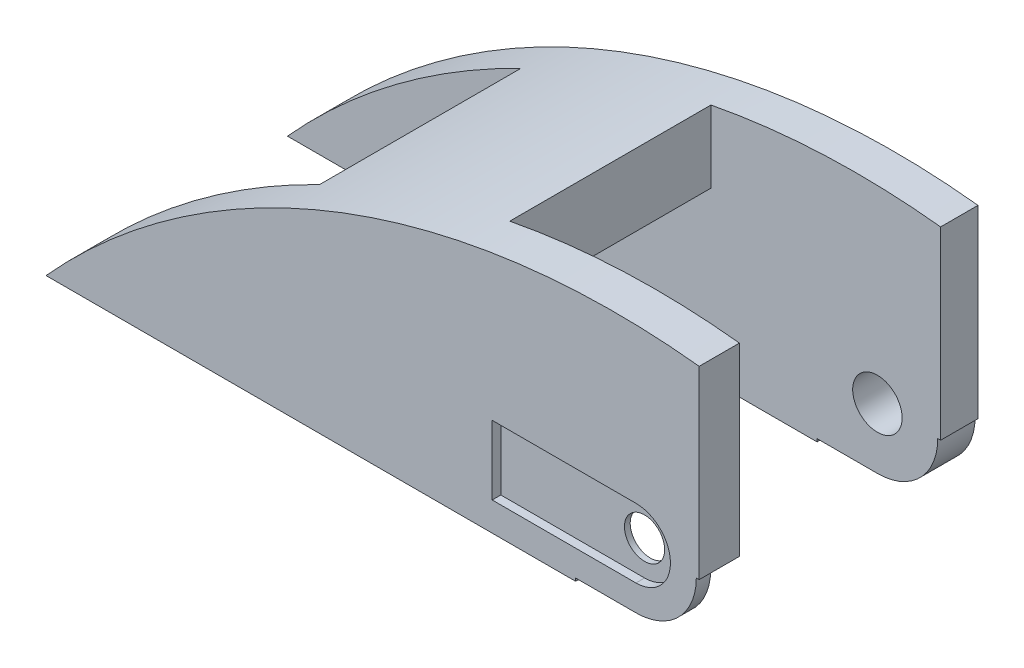
from build123d import *
from build123d.topology import SkipClean

# Parameters (mm, degrees)
SKETCH1_R                 = 9.5
BOSS_EXTRUDE1_DEPTH       = 48
CUT_EXTRUDE1_DEPTH        = 62.48170459575759
BOSS_EXTRUDE2_START       = -2.5
SKETCH3_R                 = 9.5
SKETCH3_R_2               = 2.4
BOSS_EXTRUDE2_DEPTH       = 2.5
SKETCH4_R                 = 9.5
SKETCH4_R_2               = 4.2
BOSS_EXTRUDE3_DEPTH       = 7
SKETCH5_R                 = 4.2
BOSS_EXTRUDE4_DEPTH       = 11
BOSS_EXTRUDE5_DEPTH       = 48
CUT_EXTRUDE2_START        = -48
CUT_EXTRUDE2_OUTLINE_R    = 2.65
CUT_EXTRUDE2_DEPTH        = 48
CUT_EXTRUDE3_START        = -4.5
SKETCH8_R                 = 9.5
CUT_EXTRUDE3_DEPTH        = 4.5
SKETCH9_R                 = 6.067807638148196
CUT_EXTRUDE4_DEPTH        = 4.5
SKETCH10_R                = 9.5
BOSS_EXTRUDE6_DEPTH       = 4.5
SKETCH11_R                = 4.2
BOSS_EXTRUDE7_DEPTH       = 3.5
SKETCH12_R                = 2.4
BOSS_EXTRUDE8_DEPTH       = 2.5
CUT_EXTRUDE5_DEPTH        = 14.500000000000005
SKETCH15_R                = 3.436413098279149
BOSS_EXTRUDE9_DEPTH       = 10
BOSS_EXTRUDE10_DEPTH      = 0.5
SKETCH18_R                = 4.2
CUT_EXTRUDE8_DEPTH        = 0.5
CUT_EXTRUDE9_DEPTH        = 69.52919086053767
BOSS_EXTRUDE11_DEPTH      = 6.9999999999999964
CUT_EXTRUDE10_DEPTH       = 99.24586505293748
BOSS_EXTRUDE12_DEPTH      = 41.5
SKETCH25_R                = 4.2
CUT_EXTRUDE11_DEPTH       = 0.5
BOSS_EXTRUDE13_DEPTH      = 24.25
BOSS_EXTRUDE13_DEPTH_BACK = 24.25
CUT_EXTRUDE12_DEPTH       = 17.25
CUT_EXTRUDE12_DEPTH_BACK  = 17.75
SKETCH28_W                = 40.57640869896728
SKETCH28_H                = 35.258993514097796
SKETCH28_W_2              = 40.750117962367405
SKETCH28_H_2              = 26.870649991533814
SKETCH29_R                = 2.65
SKETCH29_R_2              = 2.5
BOSS_EXTRUDE14_DEPTH      = 2.5
CUT_EXTRUDE13_DEPTH       = 119.18886786333674
SKETCH31_R                = 4.3
CUT_EXTRUDE14_DEPTH       = 111.47362122614281
CUT_EXTRUDE15_DEPTH       = 21.75
SKETCH33_R                = 3.5
CUT_EXTRUDE16_DEPTH       = 21.75
CUT_EXTRUDE17_DEPTH       = 1.5


# Read off the part's stored shape, not the designer's step: Cut-Extrude2
with BuildPart() as part:
    # Sketch1 → Boss-Extrude1 (new body)
    with BuildSketch(Plane.XY):
        with BuildLine():
            Line((-12, 0), (-12, 30))
            Line((-12, 30), (12, 30))
            Line((12, 30), (12, 0))
            ThreePointArc((12, 0), (-2.2e-15, -12), (-12, 0))
        make_face()
        Circle(SKETCH1_R, mode=Mode.SUBTRACT)
    extrude(amount=-BOSS_EXTRUDE1_DEPTH)

    # Sketch2 → Cut-Extrude1 (cut, through all)
    with BuildSketch(Plane.ZY.offset(12)):
        Polygon((-6.999999999999999, -12), (-41, -12.000000000000004), (-41, 18), (-7.000000000000001, 18.000000000000004), align=None)
    extrude(amount=-CUT_EXTRUDE1_DEPTH, mode=Mode.SUBTRACT)

    # Sketch3 → Boss-Extrude2 (add)
    with BuildSketch(Plane(origin=(0, 0, -48), x_dir=(-1, 0, 0), z_dir=(0, 0, -1)).offset(BOSS_EXTRUDE2_START)):
        Circle(SKETCH3_R)
        Circle(SKETCH3_R_2, mode=Mode.SUBTRACT)
    extrude(amount=BOSS_EXTRUDE2_DEPTH)

    # Sketch4 → Boss-Extrude3 (add)
    with BuildSketch(Plane.XY):
        with Locations(Location((0, 0, 0), (0, 0, 180))):
            Circle(SKETCH4_R)
        Circle(SKETCH4_R_2, mode=Mode.SUBTRACT)
    extrude(amount=-BOSS_EXTRUDE3_DEPTH)

    # Sketch5 → Boss-Extrude4 (add)
    with BuildSketch(Plane.XY):
        Circle(SKETCH5_R)
    extrude(amount=-BOSS_EXTRUDE4_DEPTH)

    # Sketch6 → Boss-Extrude5 (add)
    with BuildSketch(Plane(origin=(0, 0, -48), x_dir=(-1, 0, 0), z_dir=(0, 0, -1))):
        Polygon((12, 30), (12, 18), (17.999999999999925, 18), (38.00000000000001, 18), (38.00000000000001, 30), align=None)
    extrude(amount=-BOSS_EXTRUDE5_DEPTH)

    # Cut-Extrude2 outline → Cut-Extrude2 (cut)
    with BuildSketch(Plane.XY.offset(CUT_EXTRUDE2_START)):
        Circle(CUT_EXTRUDE2_OUTLINE_R)
    extrude(amount=CUT_EXTRUDE2_DEPTH, mode=Mode.SUBTRACT)

    # Sketch8 → Cut-Extrude3 (cut)
    with BuildSketch(Plane(origin=(0, -4e-16, -7), x_dir=(-1, 0, 0), z_dir=(0, -6e-17, -1)).offset(CUT_EXTRUDE3_START)):
        Circle(SKETCH8_R)
    extrude(amount=CUT_EXTRUDE3_DEPTH, mode=Mode.SUBTRACT)


with BuildPart() as cut_extrude3_piece_1:
    # of the separate pieces the step leaves, piece 1, a body of its own (cut_extrude3_pieces)
    add(part.part.solids().sort_by_distance((-12, 0, 0))[0])

    # Sketch10 → Boss-Extrude6 (add)
    with BuildSketch(Plane.XY.offset(-45.5)):
        with Locations(Location((0, 0, 0), (0, 0, 90))):
            Circle(SKETCH10_R)
    extrude(amount=BOSS_EXTRUDE6_DEPTH)

    # Sketch11 → Boss-Extrude7 (add)
    with BuildSketch(Plane.XY.offset(-41)):
        with Locations(Location((0, 0, 0), (0, 0, 180))):
            Circle(SKETCH11_R)
    extrude(amount=BOSS_EXTRUDE7_DEPTH)

    # Sketch12 → Boss-Extrude8 (add)
    with BuildSketch(Plane(origin=(0, 0, -48), x_dir=(-1, 0, 0), z_dir=(0, 0, -1))):
        Circle(SKETCH12_R)
    extrude(amount=-BOSS_EXTRUDE8_DEPTH)

    # Sketch13 → Cut-Extrude5 (cut)
    with BuildSketch(Plane(origin=(0, 30, 0), x_dir=(1, 0, 0), z_dir=(0, 1, 0))):
        Polygon((12, 41), (-23.000000000000004, 41), (-22.999999999999996, 6.999999999999988), (12, 7.000000000000001), align=None)
    extrude(amount=-CUT_EXTRUDE5_DEPTH, mode=Mode.SUBTRACT)

    # Sketch15 → Boss-Extrude9 (add)
    with BuildSketch(Plane(origin=(0, 0, -48), x_dir=(-1, 0, 0), z_dir=(0, 0, -1))):
        Circle(SKETCH15_R)
    extrude(amount=-BOSS_EXTRUDE9_DEPTH)

    # Sketch16 → Boss-Extrude10 (add)
    with BuildSketch(Plane(origin=(0, 0, -48), x_dir=(-1, 0, 0), z_dir=(0, 0, -1))):
        Polygon((38.00000000000001, 30), (-12, 30), (-12, 18), (12, 18), (38.00000000000001, 18), align=None)
        with BuildLine():
            Line((-12, 0), (11.999999999999998, 0))
            ThreePointArc((11.999999999999998, 0), (-2.2e-15, -12), (-12, 0))
        make_face()
        with BuildLine():
            ThreePointArc((11.999999999999998, 0), (7.3e-16, 11.999999999999998), (-11.999999999999998, 1.47e-15))
            Line((-12, 0), (12, 0))
        make_face()
        with BuildLine():
            Line((12, 0), (-12, 0))
            ThreePointArc((-11.999999999999998, 1.47e-15), (-2.2e-15, -11.999999999999998), (11.999999999999998, -2.94e-15))
        make_face()
        with BuildLine():
            Line((12, 18), (-12, 18))
            Line((-12, 18), (-12, 0))
            ThreePointArc((-11.999999999999998, 1.47e-15), (7.3e-16, 11.999999999999998), (11.999999999999998, 0))
            Line((11.999999999999998, 0), (11.999999999999998, 18))
        make_face()
    extrude(amount=BOSS_EXTRUDE10_DEPTH)

    # Sketch18 → Cut-Extrude8 (cut)
    with SkipClean():  # the faces are left unmerged after this step: merging them gives an invalid solid
        with BuildSketch(Plane.XY.offset(-41)):
            with BuildLine():
                Line((12.000000000000004, 30), (-22.999999999999996, 30))
                Line((-22.999999999999996, 30), (-22.999999999999996, 18))
                Line((-22.999999999999996, 18), (-12.000000000000002, 18))
                Line((-12.000000000000002, 18), (-12.000000000000002, 0))
                ThreePointArc((-12, 1.47e-15), (-2.2e-15, -12), (12, -2.94e-15))
                Line((12, 0), (12, 30))
            make_face()
            Circle(SKETCH18_R, mode=Mode.SUBTRACT)
        extrude(amount=-CUT_EXTRUDE8_DEPTH, mode=Mode.SUBTRACT)

    # Sketch19 → Cut-Extrude9 (cut, through all)
    with SkipClean():  # the faces are left unmerged after this step: merging them gives an invalid solid
        with BuildSketch(Plane.XY):
            with BuildLine():
                ThreePointArc((11, -2.69e-15), (-2.02e-15, -11), (-11, 1.35e-15))
                Line((-11, 0), (-12.000000000000002, 0))
                ThreePointArc((-12.000000000000002, 0), (-7.3e-16, -12.000000000000002), (12.000000000000002, -1.47e-15))
                Line((12, 0), (12, 30))
                Line((12, 30), (11, 30))
                Line((11, 30), (11, 0))
            make_face()
        extrude(amount=-CUT_EXTRUDE9_DEPTH, mode=Mode.SUBTRACT)

    # Sketch21 → Boss-Extrude11 (add)
    with SkipClean():  # the faces are left unmerged after this step: merging them gives an invalid solid
        with BuildSketch(Plane.XY):
            with BuildLine():
                Line((-80, -11.000000000000007), (-2.02e-15, -11))
                ThreePointArc((-2.02e-15, -11), (-11, 7.951e-14), (1.5455e-13, 11))
                Line((-9.4e-16, 11), (-2e-17, 29.50098275984317))
                ThreePointArc((1.58451e-12, 29.500982759843026), (-43.87333050880174, 16.901328954446853), (-79.99999999999999, -11.000000000000014))
            make_face()
        boss_extrude11 = extrude(amount=-BOSS_EXTRUDE11_DEPTH)

    # Mirror2: Boss-Extrude11 across plane
    with SkipClean():  # the faces are left unmerged after this step: merging them gives an invalid solid
        add(boss_extrude11.mirror(Plane.XY.offset(-24.25)))

    # Sketch23 → Cut-Extrude10 (cut, through all)
    with SkipClean():  # the faces are left unmerged after this step: merging them gives an invalid solid
        with BuildSketch(Plane.XY):
            with BuildLine():
                Line((11, 30), (-38.00000000000001, 30))
                Line((-38.00000000000001, 30), (-38.00000000000001, 19.680026503546667))
                ThreePointArc((-38.000000000000014, 19.680026503546685), (-14.03748116807828, 27.39201372395351), (10.999999999999979, 30.00000000000003))
            make_face()
        extrude(amount=-CUT_EXTRUDE10_DEPTH, mode=Mode.SUBTRACT)

    # Sketch24 → Boss-Extrude12 (add)
    with BuildSketch(Plane.XY):
        with BuildLine():
            ThreePointArc((-23.00000000000003, 25.145323923706542), (-54.060518829682096, 11.110516861146493), (-80, -11))
            Line((-80, -11.000000000000007), (-75.95443157615205, -11.000000000000004))
            ThreePointArc((-75.95443157615205, -11.000000000000028), (-51.689916223605806, 9.057380529785846), (-22.999999999999986, 22.017084465179764))
            Line((-22.999999999999996, 22.017084465179774), (-23, 25.1453239237065))
        make_face()
    extrude(amount=-BOSS_EXTRUDE12_DEPTH)

    # Sketch25 → Cut-Extrude11 (cut)
    # profile 1 of 4: a face of its own
    with BuildSketch(Plane.XY.offset(-41.5)):
        with BuildLine():
            ThreePointArc((-34.29658362177963, 17.999999999999986), (-56.6966229233105, 5.756871837942555), (-75.95443157615205, -11.000000000000028))
            Line((-75.95443157615205, -11.000000000000007), (0, -11.000000000000007))
            ThreePointArc((-2.02e-15, -11), (-7.778174593052022, 7.778174593052023), (11, 0))
            Line((10.999999999999988, 0), (10.999999999999988, 26.999999999999993))
            ThreePointArc((10.999999999999988, 26.999999999999986), (-6.181599512464837, 25.74765282571859), (-22.999999999996817, 22.017084465180716))
            Line((-23, 22.01708446518151), (-23.000000000000004, 18))
            Line((-23.000000000000004, 18), (-34.29658362177963, 18.000000000000004))
        make_face()
    # profile 2 of 4: a face of its own
    with BuildSketch(Plane.XY.offset(-41.5)):
        with BuildLine():
            ThreePointArc((11, 0), (-7.778174593052022, 7.778174593052023), (-2.02e-15, -11))
            ThreePointArc((-2.02e-15, -11), (7.778174593052021, -7.778174593052024), (11, -2.69e-15))
        make_face()
        Circle(SKETCH25_R, mode=Mode.SUBTRACT)
    # profile 3 of 4: a face of its own
    with BuildSketch(Plane.XY.offset(-41.5)):
        with BuildLine():
            Line((-15.831452239273311, 26.999999999999996), (10.999999999999986, 26.999999999999996))
            Line((11, 26.999999999999996), (11, 30))
            ThreePointArc((10.999999999999591, 30), (-2.49932247622473, 29.24767054972125), (-15.83145223927318, 26.99999999999892))
        make_face()
    # profile 4 of 4: a face of its own
    with BuildSketch(Plane.XY.offset(-41.5)):
        with BuildLine():
            ThreePointArc((-15.83145223927318, 26.99999999999892), (-19.4298595333881, 26.127289318508147), (-22.99999999999981, 25.145323923705888))
            Line((-23, 25.14532392370651), (-23, 22.01708446518151))
            ThreePointArc((-22.999999999996817, 22.017084465180716), (-6.181599512464837, 25.74765282571859), (10.999999999999988, 26.999999999999986))
            Line((10.999999999999986, 26.999999999999996), (-15.831452239273311, 26.999999999999996))
        make_face()
    extrude(amount=-CUT_EXTRUDE11_DEPTH, mode=Mode.SUBTRACT)

    # Sketch27 → Boss-Extrude13 (add, two sides: drawn at the far end of the back side and taken through both)
    with BuildSketch(Plane.XY.offset(-24.25).offset(-BOSS_EXTRUDE13_DEPTH_BACK)):
        with BuildLine():
            Line((10.999999999999988, 30), (11, 32.14))
            ThreePointArc((11, 32.14), (-51.00752842983785, 24.258993514097753), (-102.62, -11.000000000000012))
            Line((-102.62, -11.000000000000012), (-80, -11.00000000000001))
            ThreePointArc((-80, -11.00000000000001), (-38.90490957811666, 19.27675052703941), (10.999999999999988, 30))
        make_face()
    extrude(amount=BOSS_EXTRUDE13_DEPTH + BOSS_EXTRUDE13_DEPTH_BACK)

    # Sketch28 → Cut-Extrude12 (cut, two sides: drawn at the far end of the back side and taken through both)
    with BuildSketch(Plane.XY.offset(-24.25).offset(-CUT_EXTRUDE12_DEPTH_BACK)):
        with Locations((-82.33179565051637, 6.629496757048886)):
            Rectangle(SKETCH28_W, SKETCH28_H)
        with Locations((-8.579880677381787, 25.13489771564523)):
            Rectangle(SKETCH28_W_2, SKETCH28_H_2)
    extrude(amount=CUT_EXTRUDE12_DEPTH + CUT_EXTRUDE12_DEPTH_BACK, mode=Mode.SUBTRACT)

    # Sketch29 → Boss-Extrude14 (add)
    with BuildSketch(Plane.XY):
        Circle(SKETCH29_R)
        Circle(SKETCH29_R_2, mode=Mode.SUBTRACT)
    extrude(amount=-BOSS_EXTRUDE14_DEPTH)

    # Sketch30 → Cut-Extrude13 (cut, through all)
    with BuildSketch(Plane.XY):
        with BuildLine():
            ThreePointArc((-2.02e-15, -11), (7.778174593052021, -7.778174593052023), (11, 1.9e-16))
            Line((11, 0), (10.499999999999998, 0))
            ThreePointArc((10.499999999999998, -2.57e-15), (7.424621202458746, -7.4246212024587495), (-1.93e-15, -10.499999999999998))
            Line((0, -10.499999999999998), (-10.499999999999998, -10.499999999999998))
            Line((-10.499999999999998, -10.499999999999998), (-10.499999999999998, -11.000000000000002))
            Line((-10.5, -11.000000000000002), (0, -11.000000000000002))
        make_face()
    extrude(amount=-CUT_EXTRUDE13_DEPTH, mode=Mode.SUBTRACT)

    # Sketch31 → Cut-Extrude14 (cut, through all)
    with BuildSketch(Plane.XY.offset(-24.25)):
        Circle(SKETCH31_R)
    extrude(amount=-CUT_EXTRUDE14_DEPTH, mode=Mode.SUBTRACT)

    # Sketch32 → Cut-Extrude15 (cut)
    with BuildSketch(Plane.XY.offset(-24.25)):
        with BuildLine():
            Line((-9.5, -10.499999999999998), (-1.93e-15, -10.499999999999998))
            ThreePointArc((-1.93e-15, -10.499999999999998), (7.424621202458748, -7.424621202458747), (10.499999999999998, 2.31e-15))
            Line((10.499999999999998, 7e-16), (9.5, 7e-16))
            ThreePointArc((9.5, -1.63e-15), (-1.75e-15, -9.5), (-9.5, 1.86e-15))
            Line((-9.5, 7e-16), (-9.5, -10.499999999999998))
        make_face()
    extrude(amount=CUT_EXTRUDE15_DEPTH, mode=Mode.SUBTRACT)

    # Sketch33 → Cut-Extrude16 (cut)
    with BuildSketch(Plane.XY):
        Circle(SKETCH33_R)
    extrude(amount=-CUT_EXTRUDE16_DEPTH, mode=Mode.SUBTRACT)

    # Sketch34 → Cut-Extrude17 (cut)
    with BuildSketch(Plane.XY):
        with BuildLine():
            ThreePointArc((-1.1e-15, -6), (-6, 7.3e-16), (3.7e-16, 6))
            Line((0, 6), (-25, 5.9999999999999964))
            Line((-25, 5.9999999999999964), (-25, -6.0000000000000036))
            Line((-25, -6.000000000000004), (1.47e-15, -6))
        make_face()
        with BuildLine():
            ThreePointArc((6, 0), (4.242640687119286, 4.242640687119285), (3.7e-16, 6))
            Line((0, 6), (3.1e-16, 3.5))
            ThreePointArc((1.2456e-13, 3.5), (2.4748737341529603, 2.4748737341528724), (3.5, 0))
            ThreePointArc((3.5, -8.6e-16), (2.4748737341529594, -2.474873734152873), (1.237e-13, -3.5))
            Line((1.16e-15, -3.5), (1.47e-15, -6))
            ThreePointArc((-1.1e-15, -6), (4.242640687119284, -4.242640687119286), (6, -1.47e-15))
        make_face()
        with BuildLine():
            Line((3.1e-16, 3.5), (0, 6))
            ThreePointArc((3.7e-16, 6), (-6, 7.3e-16), (-1.1e-15, -6))
            Line((1.47e-15, -6), (1.16e-15, -3.5))
            ThreePointArc((1.237e-13, -3.5), (-3.5, 4.3e-16), (1.2456e-13, 3.5))
        make_face()
    extrude(amount=-CUT_EXTRUDE17_DEPTH, mode=Mode.SUBTRACT)


with BuildPart() as cut_extrude3_piece_2:
    # of the separate pieces the step leaves, piece 2, a body of its own (cut_extrude3_pieces)
    add(part.part.solids().sort_by_distance((4.2, 0, -7))[0])

    # Sketch9 → Cut-Extrude4 (cut)
    with BuildSketch(Plane(origin=(0, 0, -11), x_dir=(-1, 0, 0), z_dir=(0, 0, -1))):
        Circle(SKETCH9_R)
    extrude(amount=-CUT_EXTRUDE4_DEPTH, mode=Mode.SUBTRACT)


solid = cut_extrude3_piece_1.part
